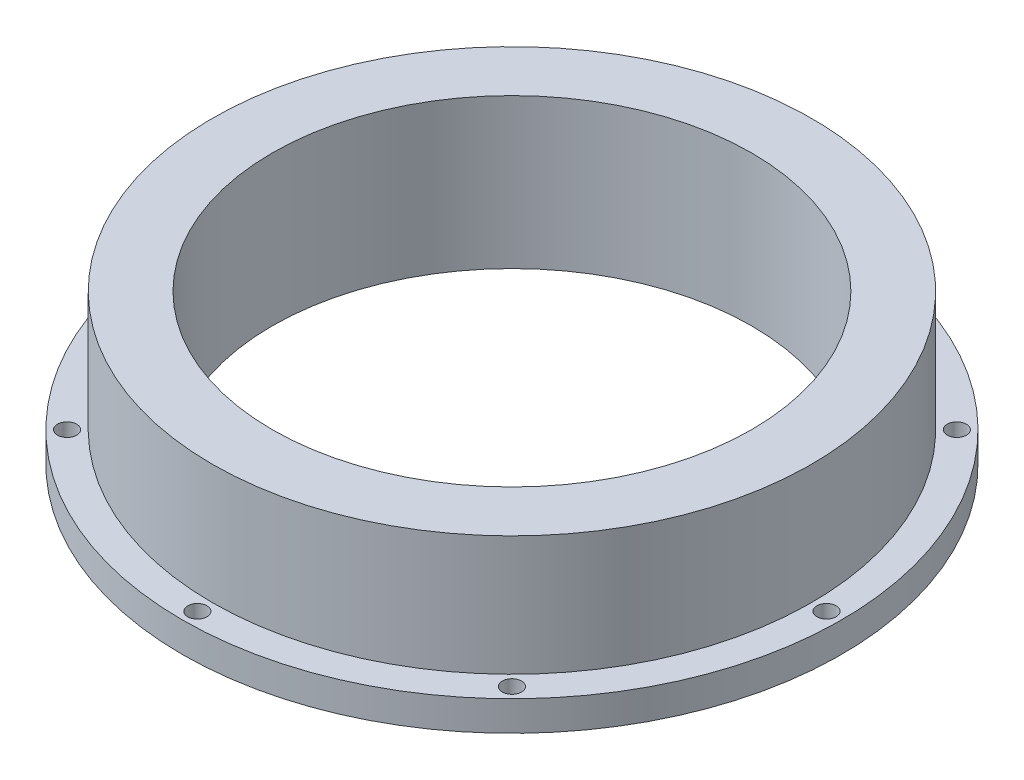
from build123d import *

# Parameters (mm, degrees)
BOSS_EXTRUDE1_OUTLINE_R   = 55
BOSS_EXTRUDE1_OUTLINE_R_2 = 1.6
BOSS_EXTRUDE1_DEPTH       = 5
SKETCH2_R                 = 50
BOSS_EXTRUDE2_DEPTH       = 20
SKETCH3_R                 = 40
CUT_EXTRUDE1_DEPTH        = 82.700673192


# Read off the part's stored shape, not the designer's step: Boss-Extrude1
with BuildPart() as part:
    # Boss-Extrude1 outline → Boss-Extrude1 (new body)
    with BuildSketch(Plane(origin=(0, 0, 0), x_dir=(1, 0, 0), z_dir=(0, 1, 0))):
        Circle(BOSS_EXTRUDE1_OUTLINE_R)
        with Locations((-37.123106012, -37.123106012)):
            Circle(BOSS_EXTRUDE1_OUTLINE_R_2, mode=Mode.SUBTRACT)
        with Locations((0, -52.5)):
            Circle(BOSS_EXTRUDE1_OUTLINE_R_2, mode=Mode.SUBTRACT)
        with Locations((37.123106012, -37.123106012)):
            Circle(BOSS_EXTRUDE1_OUTLINE_R_2, mode=Mode.SUBTRACT)
        with Locations((-52.5, 0)):
            Circle(BOSS_EXTRUDE1_OUTLINE_R_2, mode=Mode.SUBTRACT)
        with Locations((-37.123106012, 37.123106012)):
            Circle(BOSS_EXTRUDE1_OUTLINE_R_2, mode=Mode.SUBTRACT)
        with Locations((52.5, 0)):
            Circle(BOSS_EXTRUDE1_OUTLINE_R_2, mode=Mode.SUBTRACT)
        with Locations((0, 52.5)):
            Circle(BOSS_EXTRUDE1_OUTLINE_R_2, mode=Mode.SUBTRACT)
        with Locations((37.123106012, 37.123106012)):
            Circle(BOSS_EXTRUDE1_OUTLINE_R_2, mode=Mode.SUBTRACT)
    extrude(amount=BOSS_EXTRUDE1_DEPTH)

    # Sketch2 → Boss-Extrude2 (add)
    with BuildSketch(Plane(origin=(0, 5, 0), x_dir=(1, 0, 0), z_dir=(0, 1, 0))):
        with Locations(Location((0, 0, 0), (0, 0, 270))):
            Circle(SKETCH2_R)
    extrude(amount=BOSS_EXTRUDE2_DEPTH)

    # Sketch3 → Cut-Extrude1 (cut, through all)
    with BuildSketch(Plane(origin=(0, 25, 0), x_dir=(1, 0, 0), z_dir=(0, 1, 0))):
        with Locations(Location((0, 0, 0), (0, 0, 270))):
            Circle(SKETCH3_R)
    extrude(amount=-CUT_EXTRUDE1_DEPTH, mode=Mode.SUBTRACT)


solid = part.part
